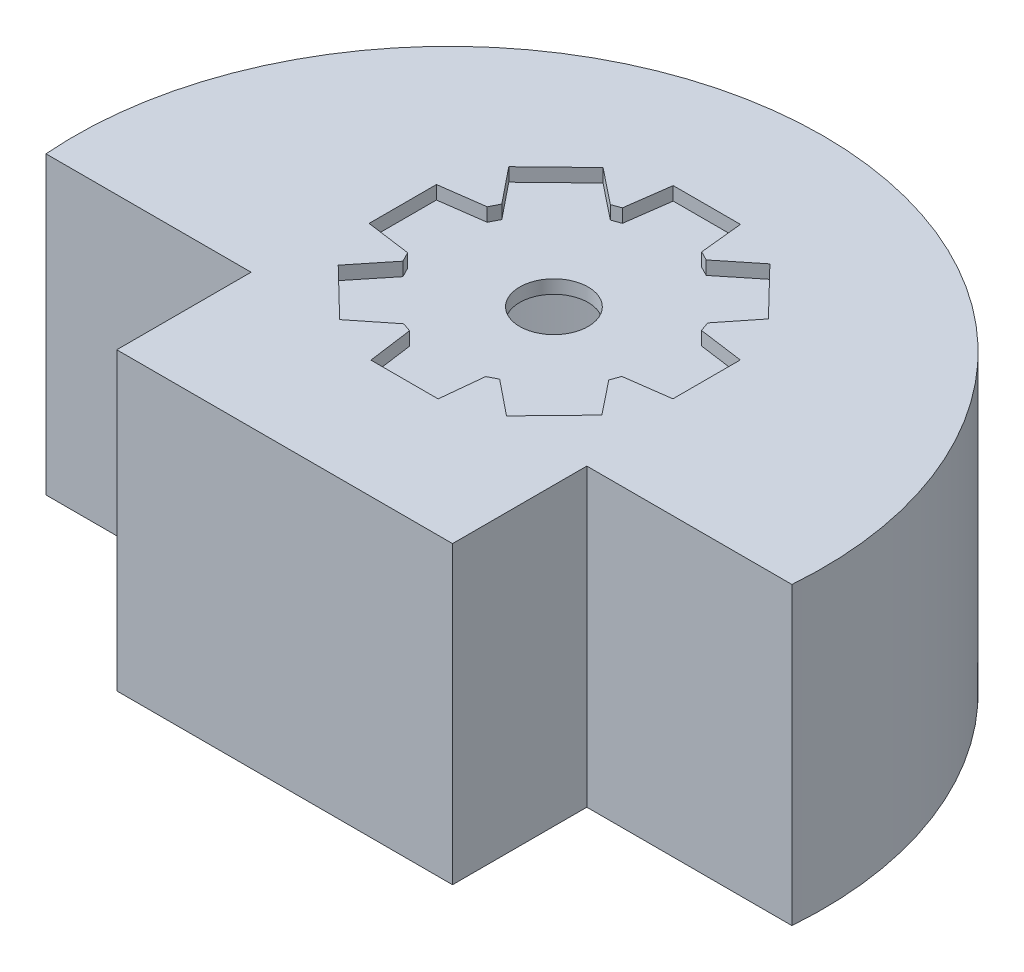
from build123d import *

# Parameters (mm, degrees)
EXTRUIR_L_MINA1_DEPTH   = 20
SALIENTE_EXTRUIR1_DEPTH = 2
EXTRUIR_L_MINA2_DEPTH   = 2.5
ENVOLVER1_START         = -1
ENVOLVER1_DEPTH         = 1
CROQUIS13_R             = 2.55
CORTAR_EXTRUIR1_DEPTH   = 54.553658795


# Read off the part's stored shape, not the designer's step: Envolver1
with BuildPart() as part:
    # Croquis1 → Extruir-Lámina1 (new body)
    with BuildSketch(Plane(origin=(0, 0, 0), x_dir=(1, 0, 0), z_dir=(0, 1, 0))):
        with BuildLine():
            Line((-27.77, 10), (-12.5, 10))
            Line((-12.5, 10), (-12.5, 0))
            Line((-12.5, 0), (12.5, 0))
            Line((12.5, 0), (12.5, 10))
            Line((12.5, 10), (27.77, 10))
            ThreePointArc((27.77, 10), (0, 40.097565641), (-27.77, 10))
        make_face()
        with BuildLine():
            Line((-25.858908766, 12), (-10.5, 12))
            Line((-10.5, 12), (-10.5, 2))
            Line((-10.5, 2), (10.5, 2))
            Line((10.5, 2), (10.5, 12))
            Line((10.5, 12), (25.858908766, 12))
            ThreePointArc((25.858908766, 12), (0, 38.097565641), (-25.858908766, 12))
        make_face(mode=Mode.SUBTRACT)
    extrude(amount=EXTRUIR_L_MINA1_DEPTH)

    # Croquis2 → Saliente-Extruir1 (add)
    with BuildSketch(Plane(origin=(0, 20, 0), x_dir=(1, 0, 0), z_dir=(0, 1, 0))):
        with BuildLine():
            Line((12.5, 10), (27.77, 10))
            ThreePointArc((27.77, 10), (0, 40.097565641), (-27.77, 10))
            Line((-27.77, 10), (-12.5, 10))
            Line((-12.5, 10), (-12.5, 0))
            Line((-12.5, 0), (12.5, 0))
            Line((12.5, 0), (12.5, 10))
        make_face()
    extrude(amount=SALIENTE_EXTRUIR1_DEPTH)

    # Envolver1 outline → Envolver1 (cut)
    with BuildSketch(Plane(origin=(0, 22, 0), x_dir=(1, 0, 0), z_dir=(0, 1, 0)).offset(ENVOLVER1_START)):
        Polygon((-3.489748997, 27.738758035), (-6.147187537, 29.854623251), (-9.711069089, 26.398480357), (-7.560564468, 23.731186854), (-7.929128313, 23.010388183), (-11.254274193, 22.556610346), (-11.254274193, 17.540955296), (-7.929128313, 17.087177459), (-7.560564468, 16.366378787), (-9.711069089, 13.699085285), (-6.147187537, 10.242942391), (-3.489748997, 12.358807607), (-2.826803524, 12.124826852), (-2.371254467, 8.794541744), (2.633615094, 8.794541744), (2.963448904, 12.006836247), (3.651797726, 12.358807607), (6.27612761, 10.242942391), (9.772472758, 13.848279425), (7.767550058, 16.366378787), (8.024300184, 17.08340881), (11.369187461, 17.540955296), (11.369187461, 22.556610346), (8.024300184, 23.014156831), (7.767550058, 23.731186854), (9.772472758, 26.249286217), (6.27612761, 29.854623251), (3.651797726, 27.738758035), (2.963448904, 28.090729394), (2.633615094, 31.303023897), (-2.371254467, 31.303023897), (-2.826803524, 27.97273879), align=None)
    extrude(amount=ENVOLVER1_DEPTH, mode=Mode.SUBTRACT)

    # Croquis13 → Cortar-Extruir1 (cut, through all)
    with BuildSketch(Plane(origin=(0, 22, 0), x_dir=(1, 0, 0), z_dir=(0, 1, 0))):
        with Locations(Location((0, 20.048782821, 0), (0, 0, 270))):
            Circle(CROQUIS13_R)
    extrude(amount=-CORTAR_EXTRUIR1_DEPTH, mode=Mode.SUBTRACT)


with BuildPart() as body_2:
    # Croquis9 → Extruir-Lámina2 (new body)
    with BuildSketch(Plane(origin=(0, 4.9, 0), x_dir=(-1, 0, 0), z_dir=(0, -1, 0))):
        with BuildLine():
            Line((-26.105447319, 11.75), (-10.75, 11.75))
            Line((-10.75, 11.75), (-10.75, 1.75))
            Line((-10.75, 1.75), (10.75, 1.75))
            Line((10.75, 1.75), (10.75, 11.75))
            Line((10.75, 11.75), (26.105447319, 11.75))
            ThreePointArc((26.105447319, 11.75), (0, 38.347565641), (-26.105447319, 11.75))
        make_face()
        with BuildLine():
            Line((-23.524077197, 14.25), (-8.25, 14.25))
            Line((-8.25, 14.25), (-8.25, 4.25))
            Line((-8.25, 4.25), (8.25, 4.25))
            Line((8.25, 4.25), (8.25, 14.25))
            Line((8.25, 14.25), (23.524077197, 14.25))
            ThreePointArc((23.524077197, 14.25), (0, 35.847565641), (-23.524077197, 14.25))
        make_face(mode=Mode.SUBTRACT)
    extrude(amount=EXTRUIR_L_MINA2_DEPTH)


solid = Compound([part.part, body_2.part])
